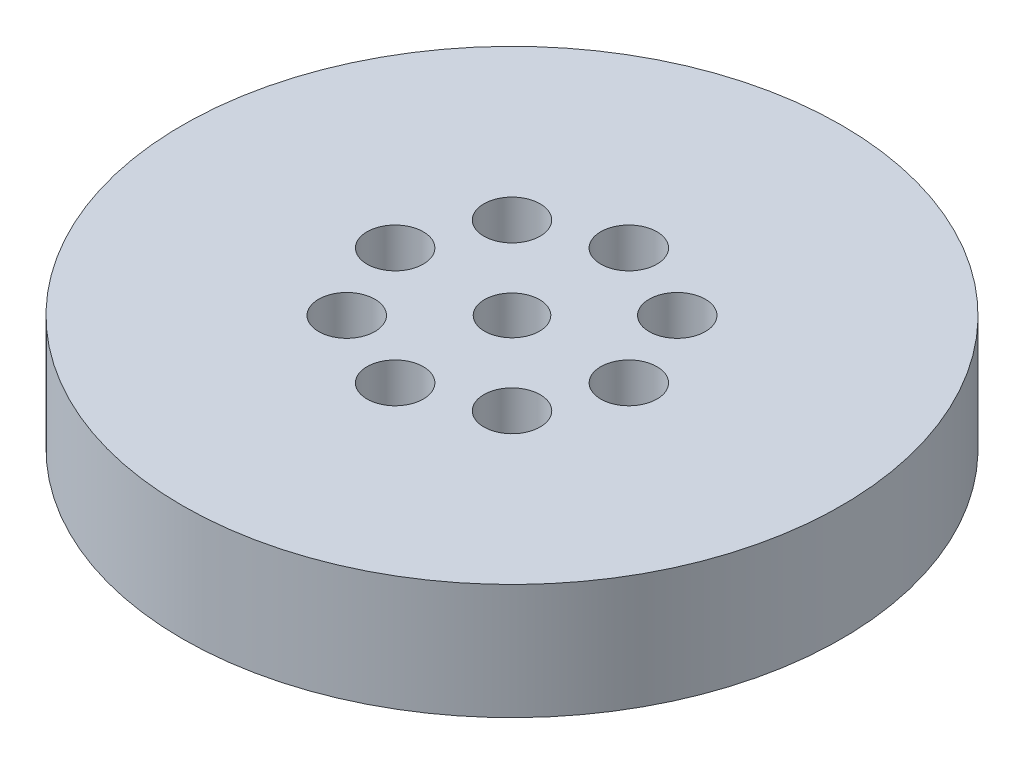
from build123d import *

# Parameters (mm, degrees)
SKETCH1_R           = 60
BOSS_EXTRUDE1_DEPTH = 21
SKETCH2_R           = 5
CUT_EXTRUDE1_DEPTH  = 88.412813706
SKETCH3_R           = 5.118647663
CUT_EXTRUDE2_DEPTH  = 18.708958538
CIRPATTERN1_COUNT   = 8


with BuildPart() as part:
    # Sketch1 → Boss-Extrude1 (new body)
    with BuildSketch(Plane(origin=(0, 0, 0), x_dir=(1, 0, 0), z_dir=(0, 1, 0))):
        Circle(SKETCH1_R)
    extrude(amount=BOSS_EXTRUDE1_DEPTH)

    # Sketch2 → Cut-Extrude1 (cut, through all)
    with BuildSketch(Plane(origin=(0, 0, 0), x_dir=(1, 0, 0), z_dir=(0, 1, 0))):
        Circle(SKETCH2_R)
    extrude(amount=CUT_EXTRUDE1_DEPTH, mode=Mode.SUBTRACT)

    # Sketch3 → Cut-Extrude2 (cut)
    with BuildSketch(Plane(origin=(0, 21, 0), x_dir=(1, 0, 0), z_dir=(0, 1, 0))):
        with Locations((-21.272750688, 0)):
            Circle(SKETCH3_R)
    cut_extrude2 = extrude(amount=-CUT_EXTRUDE2_DEPTH, mode=Mode.SUBTRACT)

    # CirPattern1: Cut-Extrude2 ×8 about axis
    cirpattern1_axis = Axis((0, 0, 0), (0, 1, 0))
    for i in range(1, CIRPATTERN1_COUNT):
        add(cut_extrude2.rotate(cirpattern1_axis, i * 360 / CIRPATTERN1_COUNT), mode=Mode.SUBTRACT)


solid = part.part
